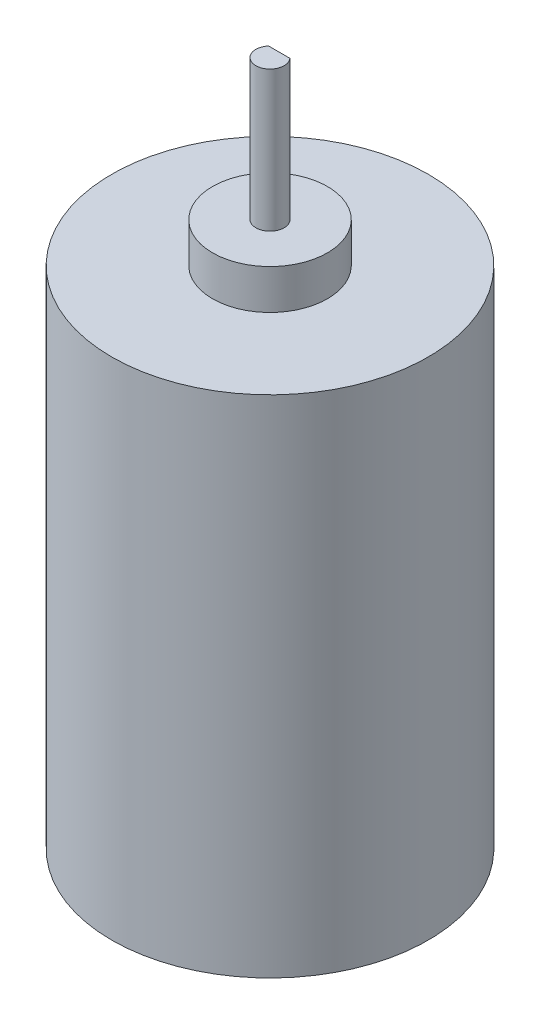
from build123d import *

# Parameters (mm, degrees)
SKETCH1_R           = 17.9
BOSS_EXTRUDE1_DEPTH = 57.12
SKETCH1_3_R         = 6.5
BOSS_EXTRUDE2_DEPTH = 4.5
BOSS_EXTRUDE3_DEPTH = 20.38


with BuildPart() as part:
    # Sketch1 → Boss-Extrude1 (new body)
    with BuildSketch(Plane(origin=(0, 0, 0), x_dir=(1, 0, 0), z_dir=(0, 1, 0))):
        Circle(SKETCH1_R)
    extrude(amount=-BOSS_EXTRUDE1_DEPTH)

    # Sketch1<3> → Boss-Extrude2 (add)
    with BuildSketch(Plane(origin=(0, 0, 0), x_dir=(1, 0, 0), z_dir=(0, 1, 0))):
        Circle(SKETCH1_3_R)
    extrude(amount=BOSS_EXTRUDE2_DEPTH)

    # Sketch1<4> → Boss-Extrude3 (add)
    with BuildSketch(Plane(origin=(0, 0, 0), x_dir=(1, 0, 0), z_dir=(0, 1, 0))):
        with BuildLine():
            ThreePointArc((-1.207269647, 1.05), (0, -1.6), (1.207269647, 1.05))
            Line((1.207269647, 1.05), (-1.207269647, 1.05))
        make_face()
    extrude(amount=BOSS_EXTRUDE3_DEPTH)


solid = part.part
